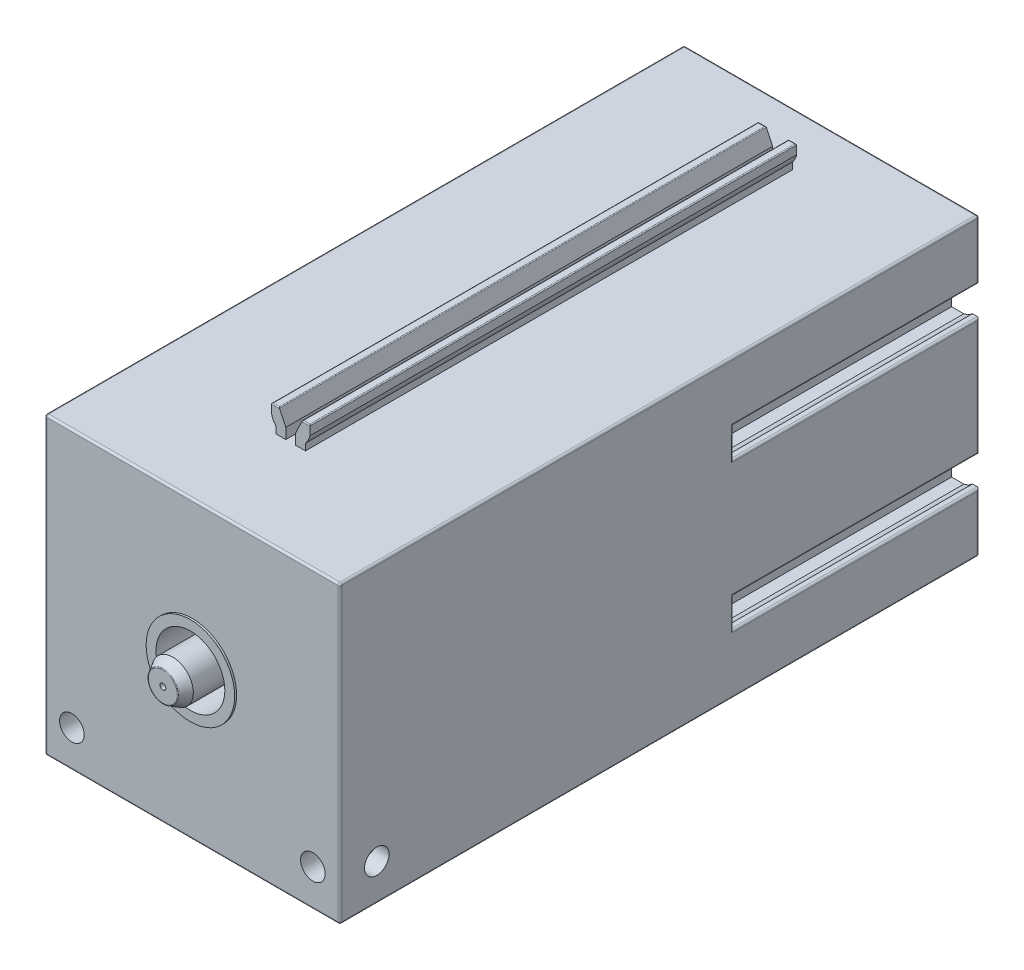
from build123d import *

# Parameters (mm, degrees)
SKETCH_1_W          = 30
SKETCH_1_H          = 30
EXTRUDE_1_DEPTH     = 65
CUT_EXTRUDE_1_DEPTH = 54
CUT_EXTRUDE_2_DEPTH = 25
EXTRUDE_START       = -5.5
EXTRUDE_2_DEPTH     = 49.5
FILLET_1_R          = 0.1
SKETCH_6_R          = 3.5
CUT_EXTRUDE_3_DEPTH = 5
EXTRUDE_START_2     = 0.2
SKETCH_7_R          = 4.5
SKETCH_7_R_2        = 3.5
EXTRUDE_3_DEPTH     = 0.2
SKETCH_8_R          = 2.1
EXTRUDE_4_DEPTH     = 8
SKETCH_9_R          = 0.3
CUT_EXTRUDE_4_DEPTH = 8
CHAMFER_1_SIZE      = 1
CHAMFER_1_SIZE2     = 0.577350269
FILLET_2_R          = 0.1
FILLET_3_R          = 0.2
SKETCH_10_R         = 1.25
CUT_EXTRUDE_5_DEPTH = 5
SKETCH_11_R         = 1.25
CUT_EXTRUDE_6_DEPTH = 5
CUT_EXTRUDE_START   = -5
SKETCH_12_R         = 1.25
CUT_EXTRUDE_7_DEPTH = 5


with BuildPart() as part:
    # 草图1 → 凸台-拉伸1 (new body)
    with BuildSketch(Plane.XY):
        with Locations((0, 15)):
            Rectangle(SKETCH_1_W, SKETCH_1_H)
    extrude(amount=-EXTRUDE_1_DEPTH)

    # 草图2 → 切除-拉伸1 (cut)
    with BuildSketch(Plane(origin=(0, 0, -65), x_dir=(-1, 0, 0), z_dir=(0, 0, -1))):
        with BuildLine():
            Line((-9, 0.677124344), (-9, 0))
            Line((-9, 0), (-6, 0))
            Line((-6, 0), (-6, 0.677124344))
            ThreePointArc((-6, 0.677124344), (-5.719957697, 1.088161527), (-5.55, 1.555590279))
            Line((-5.55, 1.555590279), (-5.55, 2.8))
            Line((-5.55, 2.8), (-9.45, 2.8))
            Line((-9.45, 2.8), (-9.45, 1.555590279))
            ThreePointArc((-9.45, 1.555590279), (-9.280042303, 1.088161527), (-9, 0.677124344))
        make_face()
        with BuildLine():
            Line((5.55, 2.8), (5.55, 1.555590279))
            ThreePointArc((5.55, 1.555590279), (5.719957697, 1.088161527), (6, 0.677124344))
            Line((6, 0.677124344), (6, 0))
            Line((6, 0), (9, 0))
            Line((9, 0), (9, 0.677124344))
            ThreePointArc((9, 0.677124344), (9.280042303, 1.088161527), (9.45, 1.555590279))
            Line((9.45, 1.555590279), (9.45, 2.8))
            Line((9.45, 2.8), (5.55, 2.8))
        make_face()
    extrude(amount=-CUT_EXTRUDE_1_DEPTH, mode=Mode.SUBTRACT)

    # 草图3 → 切除-拉伸2 (cut)
    with BuildSketch(Plane(origin=(0, 0, -65), x_dir=(-1, 0, 0), z_dir=(0, 0, -1))):
        with BuildLine():
            Line((-14.322875656, 9), (-15, 9))
            Line((-15, 9), (-15, 6))
            Line((-15, 6), (-14.322875656, 6))
            ThreePointArc((-14.322875656, 6), (-13.911838473, 5.719957697), (-13.444409721, 5.55))
            Line((-13.444409721, 5.55), (-12.2, 5.55))
            Line((-12.2, 5.55), (-12.2, 9.45))
            Line((-12.2, 9.45), (-13.444409721, 9.45))
            ThreePointArc((-13.444409721, 9.45), (-13.911838473, 9.280042303), (-14.322875656, 9))
        make_face()
        with BuildLine():
            Line((-12.2, 20.55), (-13.444409721, 20.55))
            ThreePointArc((-13.444409721, 20.55), (-13.911838473, 20.719957697), (-14.322875656, 21))
            Line((-14.322875656, 21), (-15, 21))
            Line((-15, 21), (-15, 24))
            Line((-15, 24), (-14.322875656, 24))
            ThreePointArc((-14.322875656, 24), (-13.911838473, 24.280042303), (-13.444409721, 24.45))
            Line((-13.444409721, 24.45), (-12.2, 24.45))
            Line((-12.2, 24.45), (-12.2, 20.55))
        make_face()
        with BuildLine():
            Line((14.322875656, 21), (15, 21))
            Line((15, 21), (15, 24))
            Line((15, 24), (14.322875656, 24))
            ThreePointArc((14.322875656, 24), (13.911838473, 24.280042303), (13.444409721, 24.45))
            Line((13.444409721, 24.45), (12.2, 24.45))
            Line((12.2, 24.45), (12.2, 20.55))
            Line((12.2, 20.55), (13.444409721, 20.55))
            ThreePointArc((13.444409721, 20.55), (13.911838473, 20.719957697), (14.322875656, 21))
        make_face()
        with BuildLine():
            Line((12.2, 9.45), (13.444409721, 9.45))
            ThreePointArc((13.444409721, 9.45), (13.911838473, 9.280042303), (14.322875656, 9))
            Line((14.322875656, 9), (15, 9))
            Line((15, 9), (15, 6))
            Line((15, 6), (14.322875656, 6))
            ThreePointArc((14.322875656, 6), (13.911838473, 5.719957697), (13.444409721, 5.55))
            Line((13.444409721, 5.55), (12.2, 5.55))
            Line((12.2, 5.55), (12.2, 9.45))
        make_face()
    extrude(amount=-CUT_EXTRUDE_2_DEPTH, mode=Mode.SUBTRACT)

    # 草图5 → 凸台-拉伸2 (add)
    with BuildSketch(Plane(origin=(0, 0, -65), x_dir=(-1, 0, 0), z_dir=(0, 0, -1)).offset(EXTRUDE_START)):
        with BuildLine():
            Line((-1.5, 30.677124344), (-1.5, 30))
            Line((-1.5, 30), (-0.5, 30))
            Line((-0.5, 30), (-0.5, 31.07225346))
            Line((-0.5, 31.07225346), (-1.165769145, 32.5))
            Line((-1.165769145, 32.5), (-1.95, 32.5))
            Line((-1.95, 32.5), (-1.95, 31.555590279))
            ThreePointArc((-1.95, 31.555590279), (-1.780042303, 31.088161527), (-1.5, 30.677124344))
        make_face()
        with BuildLine():
            Line((1.5, 30), (1.5, 30.677124344))
            ThreePointArc((1.5, 30.677124344), (1.780042303, 31.088161527), (1.95, 31.555590279))
            Line((1.95, 31.555590279), (1.95, 32.5))
            Line((1.95, 32.5), (1.165769145, 32.5))
            Line((1.165769145, 32.5), (0.5, 31.07225346))
            Line((0.5, 31.07225346), (0.5, 30))
            Line((0.5, 30), (1.5, 30))
        make_face()
    extrude(amount=-EXTRUDE_2_DEPTH)

    # 圆角1
    fillet_1_edges = [part.edges().sort_by_distance(p)[0] for p in [
        (-1.165769145, 32.5, -34.75),
        (-1.557884573, 32.5, -10),
        (-1.95, 32.5, -34.75),
        (-1.557884573, 32.5, -59.5),
        (1.95, 32.5, -34.75),
        (1.557884573, 32.5, -10),
        (1.165769145, 32.5, -34.75),
        (1.557884573, 32.5, -59.5),
    ]]
    fillet(fillet_1_edges, radius=FILLET_1_R)

    # 草图6 → 切除-拉伸3 (cut)
    with BuildSketch(Plane.XY):
        with Locations((0, 15)):
            Circle(SKETCH_6_R)
    extrude(amount=-CUT_EXTRUDE_3_DEPTH, mode=Mode.SUBTRACT)

    # 草图7 → 凸台-拉伸3 (add)
    with BuildSketch(Plane.XY.offset(EXTRUDE_START_2)):
        with Locations((0, 15)):
            Circle(SKETCH_7_R)
        with Locations((0, 15)):
            Circle(SKETCH_7_R_2, mode=Mode.SUBTRACT)
    extrude(amount=-EXTRUDE_3_DEPTH)

    # 草图8 → 凸台-拉伸4 (add)
    with BuildSketch(Plane.XY.offset(-5)):
        with Locations((0, 15)):
            Circle(SKETCH_8_R)
    extrude(amount=EXTRUDE_4_DEPTH)

    # 草图9 → 切除-拉伸4 (cut)
    with BuildSketch(Plane.XY.offset(3)):
        with Locations((0, 15)):
            Circle(SKETCH_9_R)
    extrude(amount=-CUT_EXTRUDE_4_DEPTH, mode=Mode.SUBTRACT)

    # 倒角1
    chamfer_1_edges = [part.edges().sort_by_distance(p)[0] for p in [
        (-2.1, 15, 3),
    ]]
    chamfer_1_side = [part.faces().sort_by_distance(p)[0] for p in [
        (-2.1, 15, -1),
    ]]
    chamfer(chamfer_1_edges, length=CHAMFER_1_SIZE, length2=CHAMFER_1_SIZE2, reference=chamfer_1_side[0])

    # 圆角2
    fillet_2_edges = [part.edges().sort_by_distance(p)[0] for p in [
        (-1.522649731, 15, 3),
    ]]
    fillet(fillet_2_edges, radius=FILLET_2_R)

    # 圆角3
    fillet_3_edges = [part.edges().sort_by_distance(p)[0] for p in [
        (-12, 0, -65),
        (0, 0, 0),
        (12, 0, -65),
        (9, 0, -38),
        (7.5, 0, -11),
        (6, 0, -38),
        (0, 0, -65),
        (-6, 0, -38),
        (-7.5, 0, -11),
        (-9, 0, -38),
        (-15, 15, -65),
        (-15, 21, -52.5),
        (-15, 22.5, -40),
        (-15, 24, -52.5),
        (-15, 27, -65),
        (-15, 30, -32.5),
        (-15, 15, 0),
        (-15, 0, -32.5),
        (-15, 3, -65),
        (-15, 6, -52.5),
        (-15, 7.5, -40),
        (-15, 9, -52.5),
        (15, 15, -65),
        (15, 9, -52.5),
        (15, 7.5, -40),
        (15, 6, -52.5),
        (15, 3, -65),
        (15, 0, -32.5),
        (15, 15, 0),
        (15, 30, -32.5),
        (15, 27, -65),
        (15, 24, -52.5),
        (15, 22.5, -40),
        (15, 21, -52.5),
        (0, 30, -65),
        (0, 30, 0),
    ]]
    fillet(fillet_3_edges, radius=FILLET_3_R)

    # 草图10 → 切除-拉伸5 (cut)
    with BuildSketch(Plane.XY):
        with Locations((-12.25, 3.75)):
            Circle(SKETCH_10_R)
        with Locations((12.25, 3.75)):
            Circle(SKETCH_10_R)
    extrude(amount=-CUT_EXTRUDE_5_DEPTH, mode=Mode.SUBTRACT)

    # 草图11 → 切除-拉伸6 (cut)
    with BuildSketch(Plane(origin=(15, 0, 0), x_dir=(0, 0, -1), z_dir=(1, 0, 0))):
        with Locations((3.75, 3.75)):
            Circle(SKETCH_11_R)
    extrude(amount=-CUT_EXTRUDE_6_DEPTH, mode=Mode.SUBTRACT)

    # 草图12 → 切除-拉伸7 (cut)
    with BuildSketch(Plane.ZY.offset(15).offset(CUT_EXTRUDE_START)):
        with Locations((-3.75, 3.75)):
            Circle(SKETCH_12_R)
    extrude(amount=CUT_EXTRUDE_7_DEPTH, mode=Mode.SUBTRACT)


solid = part.part
